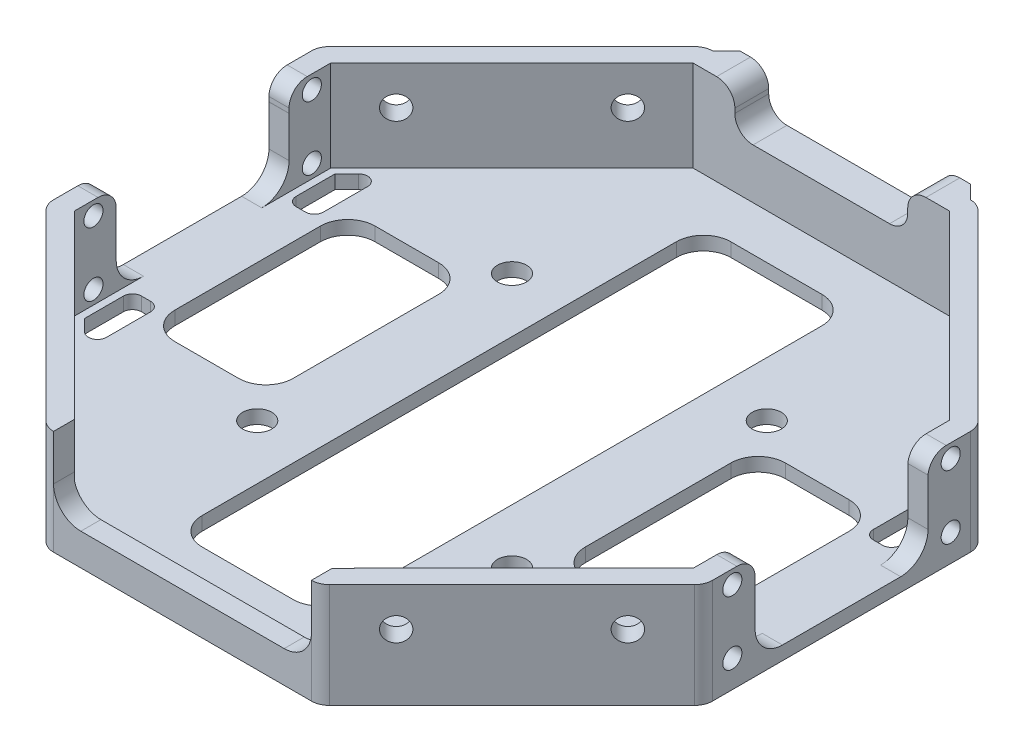
from build123d import *

# Parameters (mm, degrees)
BOSS_EXTRUDE1_DEPTH      = 11.5
SHELL1_T                 = -3
SKETCH3_R                = 1.2999999999999998
SKETCH3_R_2              = 1.3000000000000003
CUT_EXTRUDE1_DEPTH       = 94.00000000000001
SKETCH4_R                = 1.2999999999999998
SKETCH4_R_2              = 1.3000000000000003
CUT_EXTRUDE2_DEPTH       = 94.00000000000001
FILLET1_R                = 2
CUT_EXTRUDE3_DEPTH       = 79.00000000000001
CUT_EXTRUDE4_DEPTH       = 79.00000000000001
FILLET2_R                = 2
SKETCH8_R                = 1.0500000000000005
SKETCH8_R_2              = 1.0500000000000003
SKETCH8_R_3              = 1.0499999999999987
SKETCH8_R_4              = 1.049999999999999
CUT_EXTRUDE7_DEPTH       = 79.00000000000001
CUT_EXTRUDE8_DEPTH       = 1.5
CUT_EXTRUDE9_DEPTH       = 1.5
FILLET3_R                = 1
CUT_EXTRUDE10_DEPTH      = 10
FILLET4_R                = 3
SKETCH14_R               = 1.5999999999999963
SKETCH14_R_2             = 1.5999999999999985
SKETCH14_R_3             = 1.6000000000000019
CUT_EXTRUDE12_DEPTH      = 10
CUT_EXTRUDE13_DEPTH      = 10
CUT_EXTRUDE15_START      = -5.5
CUT_EXTRUDE15_DEPTH      = 10
CUT_EXTRUDE16_DEPTH      = 8
FILLET5_R                = 3
CUT_EXTRUDE17_DEPTH      = 10
CUT_EXTRUDE17_DEPTH_BACK = 10
SKETCH22_W               = 19.000319159306837
SKETCH22_H               = 13.382396161521829
CUT_EXTRUDE18_DEPTH      = 10
FILLET6_R                = 3
BOSS_EXTRUDE2_START      = 1.5
BOSS_EXTRUDE2_DEPTH      = 1.5
CHAMFER1_SIZE            = 1.5
SKETCH24_R               = 3.0999999999999996
SKETCH24_R_2             = 3.099999999999995
CUT_EXTRUDE19_DEPTH      = 3.1


# Read off the part's stored shape, not the designer's step: Cut-Extrude15
with BuildPart() as part:
    # Sketch1 → Boss-Extrude1 (new body)
    with BuildSketch(Plane(origin=(0, 0, 0), x_dir=(1, 0, 0), z_dir=(0, 1, 0))):
        Polygon((-11.213203435596682, 39.99999999999999), (18.786796564403318, 40), (40.00000000000001, 18.786796564403836), (40.00000000000001, -11.213203435596158), (18.786796564403343, -32.42640687119235), (-11.213203435596652, -32.426406871192356), (-32.426406871193336, -11.213203435596192), (-32.42640687119335, 18.786796564403808), align=None)
    extrude(amount=BOSS_EXTRUDE1_DEPTH)

    # Shell1
    shell1_openings = [part.faces().sort_by_distance(p)[0] for p in [
        (3.786796564, 11.5, -3.786796564),
    ]]
    offset(amount=SHELL1_T, openings=shell1_openings, kind=Kind.INTERSECTION)

    # Sketch3 → Cut-Extrude1 (cut)
    with BuildSketch(Plane(origin=(-21.819805153394366, 0, 21.81980515339491), x_dir=(0.7071067811865558, 0, 0.7071067811865392), z_dir=(-0.7071067811865392, 0, 0.7071067811865558))):
        with Locations((-8.999999999999996, 7.25)):
            Circle(SKETCH3_R)
        with Locations((9.000000000000004, 7.250000000000001)):
            Circle(SKETCH3_R_2)
    extrude(amount=-CUT_EXTRUDE1_DEPTH, mode=Mode.SUBTRACT)

    # Sketch4 → Cut-Extrude2 (cut)
    with BuildSketch(Plane(origin=(-25.606601717798213, 0, -25.606601717798796), x_dir=(-0.7071067811865556, 0, 0.7071067811865396), z_dir=(-0.7071067811865396, 0, -0.7071067811865556))):
        with Locations((-14.355339059326774, 7.249999999999999)):
            Circle(SKETCH4_R)
        with Locations((3.644660940673228, 7.250000000000001)):
            Circle(SKETCH4_R_2)
    extrude(amount=-CUT_EXTRUDE2_DEPTH, mode=Mode.SUBTRACT)

    # Fillet1
    fillet1_edges = [part.edges().sort_by_distance(p)[0] for p in [
        (40.00000000000001, 5.75, -18.786796564403836),
        (40.00000000000001, 5.75, 11.213203435596158),
        (18.786796564403343, 5.75, 32.42640687119235),
        (-11.213203435596652, 5.75, 32.426406871192356),
        (-32.426406871193336, 5.75, 11.213203435596192),
        (-32.42640687119335, 5.75, -18.786796564403808),
        (-11.213203435596682, 5.75, -39.99999999999999),
        (18.786796564403318, 5.75, -40),
    ]]
    fillet(fillet1_edges, radius=FILLET1_R)

    # Sketch5 → Cut-Extrude3 (cut)
    with BuildSketch(Plane.XY.offset(32.426406871192356)):
        Polygon((3.7867965644033297, 7.000000000000001), (13.28679656440333, 7.000000000000001), (13.28679656440333, 11.5), (-5.71320343559667, 11.499999999999998), (-5.71320343559667, 6.999999999999998), align=None)
    extrude(amount=-CUT_EXTRUDE3_DEPTH, mode=Mode.SUBTRACT)

    # Sketch6 → Cut-Extrude4 (cut)
    with BuildSketch(Plane.ZY.offset(32.42640687119334)):
        Polygon((-3.786796564403819, 7.000000000000001), (5.7132034355961805, 7.000000000000001), (5.7132034355961805, 11.5), (-13.286796564403819, 11.499999999999998), (-13.286796564403819, 6.999999999999998), align=None)
    extrude(amount=-CUT_EXTRUDE4_DEPTH, mode=Mode.SUBTRACT)

    # Fillet2
    fillet2_edges = [part.edges().sort_by_distance(p)[0] for p in [
        (-5.713203435596655, 6.999999999999998, -38.499999999999986),
        (-5.713203435596655, 11.499999999999998, -38.499999999999986),
        (13.286796564403344, 11.5, -38.499999999999986),
        (13.286796564403344, 7.000000000000001, -38.5),
        (-5.713203435596655, 6.999999999999998, 30.926406871192356),
        (-5.713203435596655, 11.499999999999998, 30.926406871192356),
        (13.286796564403344, 11.5, 30.926406871192352),
        (13.286796564403344, 7.000000000000001, 30.926406871192352),
        (38.500000000000014, 6.999999999999998, -13.286796564403836),
        (-30.92640687119335, 6.999999999999998, -13.286796564403804),
        (38.500000000000014, 11.499999999999998, -13.286796564403836),
        (-30.926406871193347, 11.499999999999998, -13.286796564403804),
        (38.50000000000001, 11.5, 5.713203435596163),
        (-30.92640687119334, 11.5, 5.713203435596195),
        (38.50000000000001, 7.000000000000001, 5.713203435596163),
        (-30.926406871193343, 7.000000000000001, 5.713203435596195),
    ]]
    fillet(fillet2_edges, radius=FILLET2_R)

    # Sketch8 → Cut-Extrude7 (cut)
    with BuildSketch(Plane(origin=(40.00000000000001, 0, 0), x_dir=(0, 0, -1), z_dir=(1, 0, 0))):
        with Locations((-8.213203435596162, 9.999999999999998)):
            Circle(SKETCH8_R)
        with Locations((-8.213203435596162, 2.9999999999999982)):
            Circle(SKETCH8_R_2)
        with Locations((15.786796564403838, 2.9999999999999982)):
            Circle(SKETCH8_R_3)
        with Locations(Location((15.786796564403838, 9.999999999999998, 0), (0, 0, 180))):
            Circle(SKETCH8_R_4)
    extrude(amount=-CUT_EXTRUDE7_DEPTH, mode=Mode.SUBTRACT)

    # Sketch10 → Cut-Extrude8 (cut)
    with BuildSketch(Plane(origin=(0, 3, 0), x_dir=(1, 0, 0), z_dir=(0, 1, 0))):
        Polygon((17.54415587728405, 37), (37.00000000000001, 17.544155877284528), (37.00000000000001, -9.970562748476858), (17.544155877284076, -29.426406871192345), (-9.970562748477388, -29.42640687119236), (-29.42640687119334, -9.970562748476887), (-29.426406871193354, 17.5441558772845), (-9.970562748477416, 36.99999999999999), align=None)
    extrude(amount=-CUT_EXTRUDE8_DEPTH, mode=Mode.SUBTRACT)

    # Sketch12 → Cut-Extrude9 (cut)
    with BuildSketch(Plane(origin=(0, 1.5, 0), x_dir=(1, 0, 0), z_dir=(0, 1, 0))):
        Polygon((-26.42640687119336, 20.54415587728449), (-29.426406871193354, 17.544155877284492), (-29.42640687119335, 12.2867965644038), (-26.42640687119335, 12.286796564403804), align=None)
        Polygon((-26.426406871193343, -4.713203435596194), (-29.426406871193343, -4.713203435596194), (-29.42640687119334, -9.970562748476887), (-26.426406871193343, -12.970562748476883), align=None)
        Polygon((34.00000000000004, 12.286796564403804), (37.00000000000004, 12.2867965644038), (37.000000000000036, 17.544155877284492), (34.00000000000005, 20.54415587728449), align=None)
        Polygon((37.00000000000002, -9.970562748476887), (37.000000000000036, -4.713203435596194), (34.00000000000003, -4.713203435596194), (34.00000000000003, -12.970562748476883), align=None)
    extrude(amount=-CUT_EXTRUDE9_DEPTH, mode=Mode.SUBTRACT)

    # Fillet3
    fillet3_edges = [part.edges().sort_by_distance(p)[0] for p in [
        (-26.426406871193343, 0.75, 4.713203435596194),
        (-26.426406871193343, 0.75, 12.970562748476883),
        (-29.426406871193343, 0.75, 4.713203435596194),
        (34.00000000000004, 0.75, -12.286796564403804),
        (34.00000000000005, 0.75, -20.54415587728449),
        (37.00000000000004, 0.75, -12.2867965644038),
        (37.000000000000036, 0.75, 4.713203435596194),
        (34.00000000000003, 0.75, 12.970562748476883),
        (34.00000000000003, 0.75, 4.713203435596194),
        (-29.42640687119335, 0.75, -12.2867965644038),
        (-26.42640687119336, 0.75, -20.54415587728449),
        (-26.42640687119335, 0.75, -12.286796564403804),
    ]]
    fillet(fillet3_edges, radius=FILLET3_R)

    # Sketch13 → Cut-Extrude10 (cut)
    with BuildSketch(Plane(origin=(0, 1.5, 0), x_dir=(1, 0, 0), z_dir=(0, 1, 0))):
        Polygon((3.7867965644036996, 19.83826801235532), (-4.2132034355966725, 19.838268012355304), (-4.2132034355966725, 32.8382680123553), (2.581997552908549, 32.8382680123555), (11.786796564403328, 32.8382680123553), (11.786796564403328, 19.838268012355304), align=None)
        Polygon((19.83826801234316, -7.213203435584157), (19.838268012343164, 14.786796564415848), (32.838268012343164, 14.786796564415848), (32.83826801234316, -7.213203435584163), align=None)
        Polygon((3.786796564403691, -12.264674883523622), (-4.213203435596336, -12.264674883523465), (-4.213203435596426, -25.264674883523462), (4.991595575898852, -25.264674883523803), (11.786796564403575, -25.264674883523575), (11.786796564403664, -12.264674883523577), align=None)
        Polygon((-12.264674883535776, -7.21320343558415), (-25.264674883535772, -7.21320343558415), (-25.264674883535765, 14.786796564415864), (-12.264674883535765, 14.786796564415857), align=None)
    extrude(amount=-CUT_EXTRUDE10_DEPTH, mode=Mode.SUBTRACT)

    # Fillet4
    fillet4_edges = [part.edges().sort_by_distance(p)[0] for p in [
        (32.838268012343164, 0.75, -14.786796564415848),
        (32.83826801234316, 0.75, 7.213203435584163),
        (19.83826801234316, 0.75, 7.213203435584157),
        (19.838268012343164, 0.75, -14.786796564415848),
        (-12.264674883535765, 0.75, -14.786796564415857),
        (-12.264674883535776, 0.75, 7.21320343558415),
        (-25.264674883535772, 0.75, 7.21320343558415),
        (-25.264674883535765, 0.75, -14.786796564415864),
        (11.786796564403328, 0.75, -19.838268012355304),
        (-4.2132034355966725, 0.75, -19.838268012355304),
        (-4.2132034355966725, 0.75, -32.8382680123553),
        (11.786796564403328, 0.75, -32.8382680123553),
        (11.786796564403664, 0.75, 12.264674883523577),
        (11.786796564403575, 0.75, 25.264674883523575),
        (-4.213203435596426, 0.75, 25.264674883523462),
        (-4.213203435596336, 0.75, 12.264674883523465),
    ]]
    fillet(fillet4_edges, radius=FILLET4_R)

    # Sketch14 → Cut-Extrude12 (cut)
    with BuildSketch(Plane.XZ):
        with Locations(Location((-10.213203435596116, 10.213203435586692, 0), (0, 0, 270))):
            Circle(SKETCH14_R)
        with Locations(Location((17.786796564403996, 10.213203435586276, 0), (0, 0, 270))):
            Circle(SKETCH14_R_2)
        with Locations(Location((17.786796564403485, -17.78679656441383, 0), (0, 0, 270))):
            Circle(SKETCH14_R_3)
        with Locations(Location((-10.213203435596428, -17.786796564413415, 0), (0, 0, 270))):
            Circle(SKETCH14_R_3)
    extrude(amount=-CUT_EXTRUDE12_DEPTH, mode=Mode.SUBTRACT)

    # Sketch15 → Cut-Extrude13 (cut)
    with BuildSketch(Plane(origin=(0, 0, 0), x_dir=(-1, 0, 0), z_dir=(0, -1, 0))):
        Polygon((-11.786796564403645, -15.264674883523575), (4.213203435596356, -15.264674883523465), (4.2132034355966725, 22.838268012355304), (-11.786796564403328, 22.838268012355304), align=None)
    extrude(amount=-CUT_EXTRUDE13_DEPTH, mode=Mode.SUBTRACT)

    # Cut-Extrude15 outline → Cut-Extrude15 (cut)
    with BuildSketch(Plane(origin=(0, 7.000000000000001, 0), x_dir=(1, 0, 0), z_dir=(0, 1, 0)).offset(CUT_EXTRUDE15_START)):
        Polygon((-30.21170447, -10.310082835), (-10.292846118, -30.224702016), (17.873675964, -30.22170447), (37.788295145, -10.302846118), (37.785297599, 17.863675964), (17.866439247, 37.778295145), (-10.300082835, 37.775297599), (-30.214702016, 17.856439247), (-30.21400286, 11.286796564), (-29.426406871, 11.286796564), (-29.426406871, 17.544155877), (-9.970562748, 37), (17.544155877, 37), (37, 17.544155877), (37, -9.970562748), (17.544155877, -29.426406871), (-9.970562748, -29.426406871), (-29.426406871, -9.970562748), (-29.426406871, -3.713203436), (-30.212406525, -3.713203436), align=None)
    extrude(amount=CUT_EXTRUDE15_DEPTH, mode=Mode.SUBTRACT)

    # Sketch18 → Cut-Extrude16 (cut)
    with BuildSketch(Plane(origin=(0, 11.5, 0), x_dir=(1, 0, 0), z_dir=(0, 1, 0))):
        Polygon((-10.384776310850478, -32.426406871192356), (17.958369439657165, -32.42640687119235), (17.958369439657165, -28.24649733366352), (-10.384776310850478, -28.24649733366352), align=None)
    extrude(amount=-CUT_EXTRUDE16_DEPTH, mode=Mode.SUBTRACT)

    # Fillet5
    fillet5_edges = [part.edges().sort_by_distance(p)[0] for p in [
        (17.958369439657165, 3.5, 31.281699918532304),
        (-10.384776310850478, 3.5, 31.27959912955406),
    ]]
    fillet(fillet5_edges, radius=FILLET5_R)

    # Sketch20 → Cut-Extrude17 (cut, two sides: drawn at the far end of the back side and taken through both)
    with BuildSketch(Plane(origin=(-30.21280135057157, 0, 0.00321531583795277), x_dir=(-0.00010642230034998335, 0, -0.999999994337147), z_dir=(0.9999999943371471, 0, -0.00010642230034998335)).offset(-CUT_EXTRUDE17_DEPTH_BACK)):
        Polygon((13.290011955501143, 9.5), (-5.709988152093064, 9.5), (-5.710391044233945, 1.5), (13.289928115072893, 1.5), align=None)
    extrude(amount=CUT_EXTRUDE17_DEPTH + CUT_EXTRUDE17_DEPTH_BACK, mode=Mode.SUBTRACT)

    # Sketch22 → Cut-Extrude18 (cut)
    with BuildSketch(Plane(origin=(37.78719826435453, 0, -0.00402140058583214), x_dir=(0.00010642230034961377, 0, 0.999999994337147), z_dir=(-0.9999999943371471, 0, 0.00010642230034961377))):
        with Locations((-3.789768535419461, 8.191198080760914)):
            Rectangle(SKETCH22_W, SKETCH22_H)
    extrude(amount=-CUT_EXTRUDE18_DEPTH, mode=Mode.SUBTRACT)

    # Fillet6
    fillet6_edges = [part.edges().sort_by_distance(p)[0] for p in [
        (-31.320311283361704, 1.5, -13.286595010738479),
        (-31.319300254370233, 1.5, 5.713724148568348),
        (38.892891959816524, 1.4999999999999998, -13.294067261384845),
        (38.893902988652684, 1.4999999999999998, 5.706251897921997),
    ]]
    fillet(fillet6_edges, radius=FILLET6_R)

    # Sketch23 → Boss-Extrude2 (add)
    with BuildSketch(Plane(origin=(-9.25e-15, 0, -39.99999999999999), x_dir=(-1, 0, 2.3e-16), z_dir=(-2.3e-16, 0, -1)).offset(BOSS_EXTRUDE2_START)):
        with BuildLine():
            Line((-17.95836943965716, 11.5), (-17.95836943965716, 0))
            Line((-17.95836943965716, 0), (10.384776310850498, 0))
            Line((10.384776310850498, 0), (10.384776310850498, 11.5))
            Line((10.384776310850498, 11.5), (7.713203435596646, 11.5))
            ThreePointArc((7.713203435596646, 11.5), (6.298989873223546, 10.91421356237309), (5.713203435596646, 9.499999999999986))
            Line((5.713203435596646, 9.499999999999986), (5.713203435596646, 9.000000000000002))
            ThreePointArc((5.713203435596646, 9.000000000000002), (5.127416997969741, 7.585786437626906), (3.713203435596645, 7.000000000000001))
            Line((3.713203435596645, 7.000000000000001), (-11.286796564403353, 7.000000000000001))
            ThreePointArc((-11.286796564403353, 7.000000000000001), (-12.701010126776449, 7.585786437626906), (-13.286796564403355, 9.000000000000002))
            Line((-13.286796564403355, 9.000000000000002), (-13.286796564403355, 9.5))
            ThreePointArc((-13.286796564403355, 9.5), (-13.87258300203026, 10.914213562373094), (-15.286796564403353, 11.5))
            Line((-15.286796564403353, 11.5), (-17.95836943965716, 11.5))
        make_face()
    extrude(amount=-BOSS_EXTRUDE2_DEPTH)

    # Chamfer1
    chamfer1_edges = [part.edges().sort_by_distance(p)[0] for p in [
        (-10.384776310850507, 5.75, -41.49999999999999),
        (17.95836943965715, 5.75, -41.5),
    ]]
    chamfer(chamfer1_edges, length=CHAMFER1_SIZE - 0.0001)  # a hair under: the kernel refuses the full size

    # Sketch24 → Cut-Extrude19 (cut)
    with BuildSketch(Plane(origin=(-9.6e-15, 0, -41.49999999999999), x_dir=(-1, 0, 2.3e-16), z_dir=(-2.3e-16, 0, -1))):
        with Locations((4.213203435596646, 3.5000000000000013)):
            Circle(SKETCH24_R)
        with Locations((-11.78679656440334, 3.499999999999952)):
            Circle(SKETCH24_R_2)
    extrude(amount=-CUT_EXTRUDE19_DEPTH, mode=Mode.SUBTRACT)


solid = part.part
